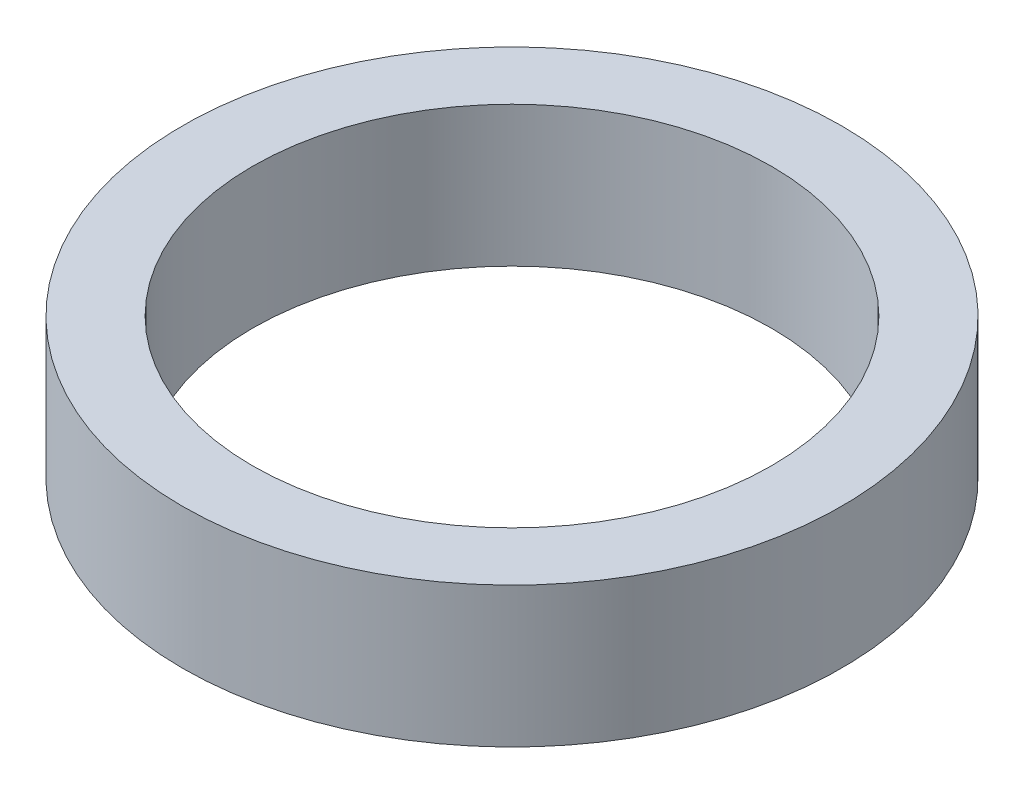
from build123d import *

# Parameters (mm, degrees)
SKETCH1_R           = 29.845
SKETCH1_R_2         = 23.495
BOSS_EXTRUDE2_DEPTH = 12.7


# Read off the part's stored shape, not the designer's step: Cut-Revolve2
with BuildPart() as part:
    # Sketch1 → Boss-Extrude2 (new body)
    with BuildSketch(Plane(origin=(0, 0, 0), x_dir=(1, 0, 0), z_dir=(0, 1, 0))):
        with Locations(Location((0, 0, 0), (0, 0, 270))):
            Circle(SKETCH1_R)
        with Locations(Location((0, 0, 0), (0, 0, 270))):
            Circle(SKETCH1_R_2, mode=Mode.SUBTRACT)
    extrude(amount=BOSS_EXTRUDE2_DEPTH)

    # Cut-Revolve2 outline → Cut-Revolve2 (revolve, cut)
    with BuildSketch(Plane.XY):
        with BuildLine():
            ThreePointArc((29.845, 0), (26.67, 3.175), (23.495, 0))
            Line((23.495, 0), (29.845, 0))
        make_face()
    revolve(axis=Axis((0, 0, 0), (0, 1, 0)), mode=Mode.SUBTRACT)


solid = part.part
